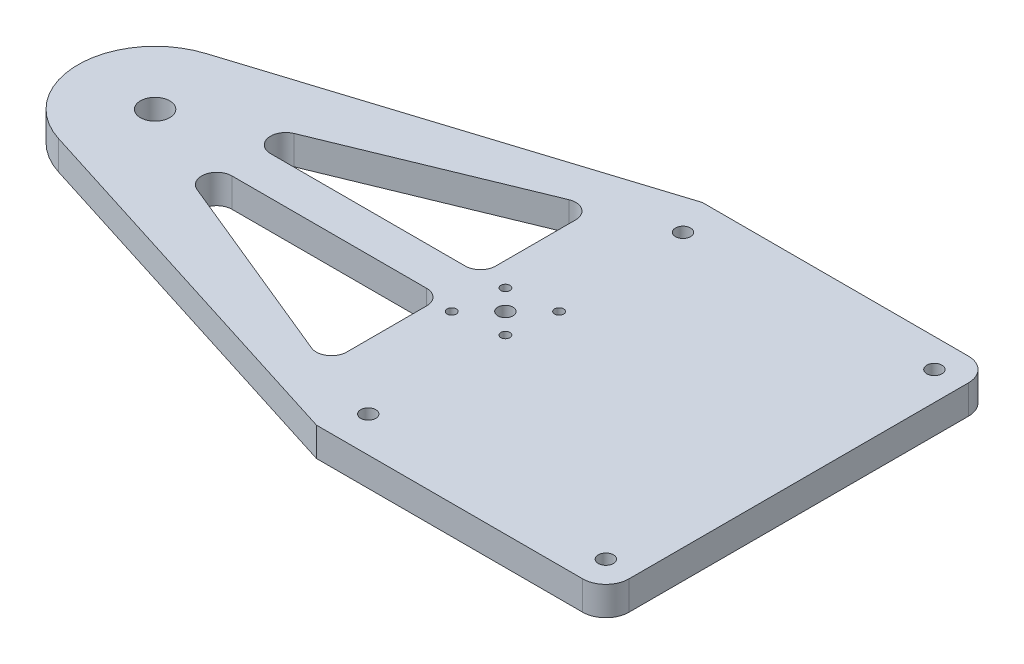
from build123d import *

# Parameters (mm, degrees)
SKETCH1_W           = 95.25
SKETCH1_H           = 127
BOSS_EXTRUDE1_DEPTH = 9.525
BOSS_EXTRUDE3_DEPTH = 9.525
SKETCH5_R           = 4.826
SKETCH5_R_2         = 2.5
SKETCH5_R_3         = 1.5
CUT_EXTRUDE1_DEPTH  = 201.236295422
CUT_EXTRUDE2_DEPTH  = 201.236295422
FILLET9_R           = 5
FILLET10_R          = 7.62
SKETCH7_R           = 2.4892
CUT_EXTRUDE3_DEPTH  = 201.236295422


with BuildPart() as part:
    # Sketch1 → Boss-Extrude1 (new body)
    with BuildSketch(Plane(origin=(0, 0, 0), x_dir=(1, 0, 0), z_dir=(0, 1, 0))):
        Rectangle(SKETCH1_W, SKETCH1_H)
    extrude(amount=BOSS_EXTRUDE1_DEPTH)

    # Sketch4 → Boss-Extrude3 (add)
    with BuildSketch(Plane(origin=(0, 9.525, 0), x_dir=(1, 0, 0), z_dir=(0, 1, 0))):
        with BuildLine():
            Line((-47.625, 63.5), (-171.916018217, 24.219268021))
            ThreePointArc((-171.916018217, 24.219268021), (-189.6618, 0), (-171.916018217, -24.219268021))
            Line((-171.916018217, -24.219268021), (-47.625, -63.5))
            Line((-47.625, -63.5), (-47.625, 63.5))
        make_face()
    extrude(amount=-BOSS_EXTRUDE3_DEPTH)

    # Sketch5 → Cut-Extrude1 (cut, through all)
    with BuildSketch(Plane(origin=(0, 9.525, 0), x_dir=(1, 0, 0), z_dir=(0, 1, 0))):
        with Locations((-164.2618, 0)):
            Circle(SKETCH5_R)
        with Locations((-48.9458, 0)):
            Circle(SKETCH5_R_2)
        with Locations((-42.228285579, -6.717514421)):
            Circle(SKETCH5_R_3)
        with Locations((-40.106965235, 8.838834765)):
            Circle(SKETCH5_R_3)
        with Locations((-57.784634765, -8.838834765)):
            Circle(SKETCH5_R_3)
        with Locations((-55.663314421, 6.717514421)):
            Circle(SKETCH5_R_3)
    extrude(amount=-CUT_EXTRUDE1_DEPTH, mode=Mode.SUBTRACT)

    # Sketch6 → Cut-Extrude2 (cut, through all)
    with BuildSketch(Plane(origin=(0, 9.525, 0), x_dir=(1, 0, 0), z_dir=(0, 1, 0))):
        Polygon((-63.5, 45.163743355), (-157.9118, 6.35), (-63.5, 6.35), align=None)
        Polygon((-63.5, -6.35), (-63.5, -45.163743355), (-157.9118, -6.35), align=None)
    extrude(amount=-CUT_EXTRUDE2_DEPTH, mode=Mode.SUBTRACT)

    # Fillet9
    fillet9_edges = [part.edges().sort_by_distance(p)[0] for p in [
        (-157.9118, 4.7625, 6.35),
        (-63.5, 4.7625, 6.35),
        (-63.5, 4.7625, 45.163743355),
        (-63.5, 4.7625, -6.35),
        (-157.9118, 4.7625, -6.35),
        (-63.5, 4.7625, -45.163743355),
    ]]
    fillet(fillet9_edges, radius=FILLET9_R)

    # Fillet10
    fillet10_edges = [part.edges().sort_by_distance(p)[0] for p in [
        (47.625, 4.7625, -63.5),
        (47.625, 4.7625, 63.5),
    ]]
    fillet(fillet10_edges, radius=FILLET10_R)

    # Sketch7 → Cut-Extrude3 (cut, through all)
    with BuildSketch(Plane(origin=(0, 9.525, 0), x_dir=(1, 0, 0), z_dir=(0, 1, 0))):
        with Locations((-42.286053483, -51.811053483)):
            Circle(SKETCH7_R)
        with Locations((-42.286053483, 51.811053483)):
            Circle(SKETCH7_R)
        with Locations((38.202339924, 54.077339924)):
            Circle(SKETCH7_R)
        with Locations((38.202339924, -54.077339924)):
            Circle(SKETCH7_R)
    extrude(amount=-CUT_EXTRUDE3_DEPTH, mode=Mode.SUBTRACT)


solid = part.part
